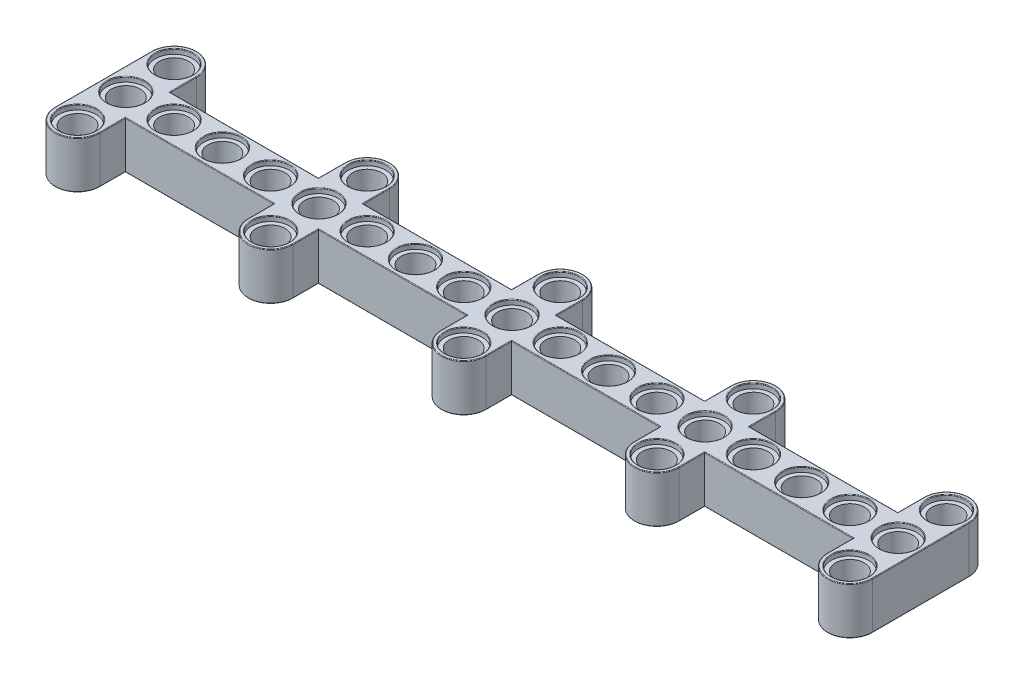
from build123d import *

# Parameters (mm, degrees)
IZIM1_W                     = 7.4
IZIM1_H                     = 7.8
Y_KSEKLIK_EKSTR_ZYON1_DEPTH = 23.4
IZIM2_R                     = 2.4
KES_EKSTR_ZYON1_DEPTH       = 7.8
RADYUS1_RADIUS              = 3.7
RADYUS1_LENGTH              = 7.8
RADYUS2_RADIUS              = 3.7
RADYUS2_LENGTH              = 7.8
IZIM3_R                     = 3.1
KES_EKSTR_ZYON2_DEPTH       = 0.8
KES_EKSTR_ZYON3_START       = -0.8
IZIM4_R                     = 3.1
KES_EKSTR_ZYON3_DEPTH       = 0.8
IZIM5_W                     = 7.4
IZIM5_H                     = 7.8
Y_KSEKLIK_EKSTR_ZYON2_DEPTH = 128
IZIM6_R                     = 2.4
KES_EKSTR_ZYON4_DEPTH       = 7.8
IZIM7_R                     = 3.1
KES_EKSTR_ZYON5_DEPTH       = 0.8
IZIM8_W                     = 7.4
IZIM8_H                     = 23.4
Y_KSEKLIK_EKSTR_ZYON3_DEPTH = 7.8
IZIM11_W                    = 7.4
IZIM11_H                    = 23.4
Y_KSEKLIK_EKSTR_ZYON5_DEPTH = 7.8
IZIM12_R                    = 2.4
KES_EKSTR_ZYON6_DEPTH       = 7.8
IZIM13_R                    = 3.1
KES_EKSTR_ZYON7_DEPTH       = 0.8
RADYUS3_RADIUS              = 3.7
RADYUS3_LENGTH              = 7.8
RADYUS4_RADIUS              = 3.7
RADYUS4_LENGTH              = 7.8
RADYUS5_RADIUS              = 3.7
RADYUS5_LENGTH              = 7.8
RADYUS6_RADIUS              = 3.7
RADYUS6_LENGTH              = 7.8
RADYUS7_RADIUS              = 3.7
RADYUS7_LENGTH              = 7.8
RADYUS8_RADIUS              = 3.7
RADYUS8_LENGTH              = 7.8
RADYUS9_RADIUS              = 3.7
RADYUS9_LENGTH              = 7.8
RADYUS10_RADIUS             = 3.7
RADYUS10_LENGTH             = 7.8
IZIM15_R                    = 2.4
KES_EKSTR_ZYON8_DEPTH       = 7.8
IZIM16_R                    = 3.1
KES_EKSTR_ZYON9_DEPTH       = 0.8
RADYUS11_R                  = 0.1
RADYUS12_R                  = 0.1


with BuildPart() as part:
    # Çizim1 → Yükseklik-Ekstrüzyon1 (new body)
    with BuildSketch(Plane.XY):
        Rectangle(IZIM1_W, IZIM1_H)
    extrude(amount=Y_KSEKLIK_EKSTR_ZYON1_DEPTH)

    # Çizim2 → Kes-Ekstrüzyon1 (cut)
    with BuildSketch(Plane(origin=(0, 3.9, 0), x_dir=(1, 0, 0), z_dir=(0, 1, 0))):
        with Locations(Location((0, -11.7, 0), (0, 0, 270))):
            Circle(IZIM2_R)
        with Locations(Location((0, -3.7, 0), (0, 0, 270))):
            Circle(IZIM2_R)
        with Locations(Location((0, -19.7, 0), (0, 0, 270))):
            Circle(IZIM2_R)
    extrude(amount=-KES_EKSTR_ZYON1_DEPTH, mode=Mode.SUBTRACT)

    # Radyus1: full round fillet: the end face becomes a half cylinder, R = half its width
    radyus1_face = Plane((0, 0, 23.4), x_dir=(0, -1, 0), z_dir=(0, 0, 1))  # on the end face: x along it, z out of the body
    radyus1_slab = radyus1_face.offset(-RADYUS1_RADIUS / 2) * Box(RADYUS1_LENGTH, 2 * RADYUS1_RADIUS, RADYUS1_RADIUS, mode=Mode.PRIVATE)  # the body's end, R deep
    radyus1_round = Plane((0, 0, 19.7), x_dir=(0, 0, 1), z_dir=(0, -1, 0)) * Cylinder(RADYUS1_RADIUS, RADYUS1_LENGTH, mode=Mode.PRIVATE)  # its axis R under the face
    add(radyus1_slab - radyus1_round, mode=Mode.SUBTRACT)

    # Radyus2: full round fillet: the end face becomes a half cylinder, R = half its width
    radyus2_face = Plane((0, 0, 0), x_dir=(0, 1, 0), z_dir=(0, 0, -1))  # on the end face: x along it, z out of the body
    radyus2_slab = radyus2_face.offset(-RADYUS2_RADIUS / 2) * Box(RADYUS2_LENGTH, 2 * RADYUS2_RADIUS, RADYUS2_RADIUS, mode=Mode.PRIVATE)  # the body's end, R deep
    radyus2_round = Plane((0, 0, 3.7), x_dir=(0, 0, -1), z_dir=(0, 1, 0)) * Cylinder(RADYUS2_RADIUS, RADYUS2_LENGTH, mode=Mode.PRIVATE)  # its axis R under the face
    add(radyus2_slab - radyus2_round, mode=Mode.SUBTRACT)

    # Çizim3 → Kes-Ekstrüzyon2 (cut)
    with BuildSketch(Plane(origin=(0, 3.9, 0), x_dir=(1, 0, 0), z_dir=(0, 1, 0))):
        with Locations(Location((0, -3.7, 0), (0, 0, 270))):
            Circle(IZIM3_R)
        with Locations(Location((0, -11.7, 0), (0, 0, 270))):
            Circle(IZIM3_R)
        with Locations(Location((0, -19.7, 0), (0, 0, 270))):
            Circle(IZIM3_R)
    extrude(amount=-KES_EKSTR_ZYON2_DEPTH, mode=Mode.SUBTRACT)

    # Çizim4 → Kes-Ekstrüzyon3 (cut)
    with BuildSketch(Plane(origin=(0, -3.9, 0), x_dir=(-1, 0, 0), z_dir=(0, -1, 0)).offset(KES_EKSTR_ZYON3_START)):
        with Locations(Location((0, -3.7, 0), (0, 0, 270))):
            Circle(IZIM4_R)
        with Locations(Location((0, -11.7, 0), (0, 0, 270))):
            Circle(IZIM4_R)
        with Locations(Location((0, -19.7, 0), (0, 0, 270))):
            Circle(IZIM4_R)
    extrude(amount=KES_EKSTR_ZYON3_DEPTH, mode=Mode.SUBTRACT)

    # Çizim5 → Yükseklik-Ekstrüzyon2 (add)
    with BuildSketch(Plane(origin=(3.7, 0, 0), x_dir=(0, 0, -1), z_dir=(1, 0, 0))):
        with Locations((-11.769993107, 0)):
            Rectangle(IZIM5_W, IZIM5_H)
    extrude(amount=Y_KSEKLIK_EKSTR_ZYON2_DEPTH)

    # Çizim6 → Kes-Ekstrüzyon4 (cut)
    with BuildSketch(Plane(origin=(0, 3.9, 0), x_dir=(1, 0, 0), z_dir=(0, 1, 0))):
        with Locations(Location((8, -11.7, 0), (0, 0, 270))):
            Circle(IZIM6_R)
        with Locations(Location((16, -11.7, 0), (0, 0, 270))):
            Circle(IZIM6_R)
        with Locations(Location((24, -11.7, 0), (0, 0, 270))):
            Circle(IZIM6_R)
        with Locations(Location((32, -11.7, 0), (0, 0, 270))):
            Circle(IZIM6_R)
        with Locations(Location((40, -11.7, 0), (0, 0, 270))):
            Circle(IZIM6_R)
        with Locations(Location((48, -11.7, 0), (0, 0, 270))):
            Circle(IZIM6_R)
        with Locations(Location((56, -11.7, 0), (0, 0, 270))):
            Circle(IZIM6_R)
        with Locations(Location((64, -11.7, 0), (0, 0, 270))):
            Circle(IZIM6_R)
        with Locations(Location((72, -11.7, 0), (0, 0, 270))):
            Circle(IZIM6_R)
        with Locations(Location((80, -11.7, 0), (0, 0, 270))):
            Circle(IZIM6_R)
        with Locations(Location((88, -11.7, 0), (0, 0, 270))):
            Circle(IZIM6_R)
        with Locations(Location((96, -11.7, 0), (0, 0, 270))):
            Circle(IZIM6_R)
        with Locations(Location((104, -11.7, 0), (0, 0, 270))):
            Circle(IZIM6_R)
        with Locations(Location((112, -11.7, 0), (0, 0, 270))):
            Circle(IZIM6_R)
    extrude(amount=-KES_EKSTR_ZYON4_DEPTH, mode=Mode.SUBTRACT)

    # Çizim7 → Kes-Ekstrüzyon5 (cut)
    with BuildSketch(Plane(origin=(0, 3.9, 0), x_dir=(1, 0, 0), z_dir=(0, 1, 0))):
        with Locations(Location((8, -11.7, 0), (0, 0, 270))):
            Circle(IZIM7_R)
        with Locations(Location((16, -11.7, 0), (0, 0, 270))):
            Circle(IZIM7_R)
        with Locations(Location((24, -11.7, 0), (0, 0, 270))):
            Circle(IZIM7_R)
        with Locations(Location((32, -11.7, 0), (0, 0, 270))):
            Circle(IZIM7_R)
        with Locations(Location((40, -11.7, 0), (0, 0, 270))):
            Circle(IZIM7_R)
        with Locations(Location((48, -11.7, 0), (0, 0, 270))):
            Circle(IZIM7_R)
        with Locations(Location((56, -11.7, 0), (0, 0, 270))):
            Circle(IZIM7_R)
        with Locations(Location((64, -11.7, 0), (0, 0, 270))):
            Circle(IZIM7_R)
        with Locations(Location((72, -11.7, 0), (0, 0, 270))):
            Circle(IZIM7_R)
        with Locations(Location((80, -11.7, 0), (0, 0, 270))):
            Circle(IZIM7_R)
        with Locations(Location((88, -11.7, 0), (0, 0, 270))):
            Circle(IZIM7_R)
        with Locations(Location((96, -11.7, 0), (0, 0, 270))):
            Circle(IZIM7_R)
        with Locations(Location((104, -11.7, 0), (0, 0, 270))):
            Circle(IZIM7_R)
        with Locations(Location((112, -11.7, 0), (0, 0, 270))):
            Circle(IZIM7_R)
    kes_ekstr_zyon5 = extrude(amount=-KES_EKSTR_ZYON5_DEPTH, mode=Mode.SUBTRACT)

    # Aynalama1: Kes-Ekstrüzyon5 across plane
    add(kes_ekstr_zyon5.mirror(Plane.ZX), mode=Mode.SUBTRACT)

    # Çizim8 → Yükseklik-Ekstrüzyon3 (add)
    with BuildSketch(Plane.XZ.offset(3.9)):
        with Locations((32, 11.7)):
            Rectangle(IZIM8_W, IZIM8_H)
    extrude(amount=-Y_KSEKLIK_EKSTR_ZYON3_DEPTH)

    # Çizim11 → Yükseklik-Ekstrüzyon5 (add)
    with BuildSketch(Plane.XZ.offset(3.9)):
        with Locations((64, 11.7)):
            Rectangle(IZIM11_W, IZIM11_H)
        with Locations((32, 11.7)):
            Rectangle(IZIM11_W, IZIM11_H)
        with Locations((96, 11.7)):
            Rectangle(IZIM11_W, IZIM11_H)
        with Locations((128, 11.7)):
            Rectangle(IZIM11_W, IZIM11_H)
    extrude(amount=-Y_KSEKLIK_EKSTR_ZYON5_DEPTH)

    # Çizim12 → Kes-Ekstrüzyon6 (cut)
    with BuildSketch(Plane(origin=(0, 3.9, 0), x_dir=(1, 0, 0), z_dir=(0, 1, 0))):
        with Locations(Location((32, -3.7, 0), (0, 0, 270))):
            Circle(IZIM12_R)
        with Locations(Location((32, -19.7, 0), (0, 0, 270))):
            Circle(IZIM12_R)
        with Locations(Location((64, -19.7, 0), (0, 0, 270))):
            Circle(IZIM12_R)
        with Locations(Location((32, -11.7, 0), (0, 0, 270))):
            Circle(IZIM12_R)
        with Locations(Location((64, -3.7, 0), (0, 0, 270))):
            Circle(IZIM12_R)
        with Locations(Location((96, -19.7, 0), (0, 0, 270))):
            Circle(IZIM12_R)
        with Locations(Location((64, -11.7, 0), (0, 0, 270))):
            Circle(IZIM12_R)
        with Locations(Location((96, -3.7, 0), (0, 0, 270))):
            Circle(IZIM12_R)
        with Locations(Location((128, -19.7, 0), (0, 0, 270))):
            Circle(IZIM12_R)
        with Locations(Location((96, -11.7, 0), (0, 0, 270))):
            Circle(IZIM12_R)
        with Locations(Location((128, -3.7, 0), (0, 0, 270))):
            Circle(IZIM12_R)
        with Locations(Location((128, -11.7, 0), (0, 0, 270))):
            Circle(IZIM12_R)
    extrude(amount=-KES_EKSTR_ZYON6_DEPTH, mode=Mode.SUBTRACT)

    # Çizim13 → Kes-Ekstrüzyon7 (cut)
    with BuildSketch(Plane(origin=(0, 3.9, 0), x_dir=(1, 0, 0), z_dir=(0, 1, 0))):
        with Locations(Location((32, -3.7, 0), (0, 0, 270))):
            Circle(IZIM13_R)
        with Locations(Location((32, -11.7, 0), (0, 0, 270))):
            Circle(IZIM13_R)
        with Locations(Location((32, -19.7, 0), (0, 0, 270))):
            Circle(IZIM13_R)
        with Locations(Location((64, -11.7, 0), (0, 0, 270))):
            Circle(IZIM13_R)
        with Locations(Location((64, -19.7, 0), (0, 0, 270))):
            Circle(IZIM13_R)
        with Locations(Location((64, -3.7, 0), (0, 0, 270))):
            Circle(IZIM13_R)
        with Locations(Location((96, -11.7, 0), (0, 0, 270))):
            Circle(IZIM13_R)
        with Locations(Location((96, -19.7, 0), (0, 0, 270))):
            Circle(IZIM13_R)
        with Locations(Location((96, -3.7, 0), (0, 0, 270))):
            Circle(IZIM13_R)
        with Locations(Location((128, -11.7, 0), (0, 0, 270))):
            Circle(IZIM13_R)
        with Locations(Location((128, -19.7, 0), (0, 0, 270))):
            Circle(IZIM13_R)
        with Locations(Location((128, -3.7, 0), (0, 0, 270))):
            Circle(IZIM13_R)
    kes_ekstr_zyon7 = extrude(amount=-KES_EKSTR_ZYON7_DEPTH, mode=Mode.SUBTRACT)

    # Aynalama2: Kes-Ekstrüzyon7 across plane
    add(kes_ekstr_zyon7.mirror(Plane.ZX), mode=Mode.SUBTRACT)

    # Radyus3: full round fillet: the end face becomes a half cylinder, R = half its width
    radyus3_face = Plane((32, 0, 0), x_dir=(0, 1, 0), z_dir=(0, 0, -1))  # on the end face: x along it, z out of the body
    radyus3_slab = radyus3_face.offset(-RADYUS3_RADIUS / 2) * Box(RADYUS3_LENGTH, 2 * RADYUS3_RADIUS, RADYUS3_RADIUS, mode=Mode.PRIVATE)  # the body's end, R deep
    radyus3_round = Plane((32, 0, 3.7), x_dir=(0, 0, -1), z_dir=(0, 1, 0)) * Cylinder(RADYUS3_RADIUS, RADYUS3_LENGTH, mode=Mode.PRIVATE)  # its axis R under the face
    add(radyus3_slab - radyus3_round, mode=Mode.SUBTRACT)

    # Radyus4: full round fillet: the end face becomes a half cylinder, R = half its width
    radyus4_face = Plane((32, 0, 23.4), x_dir=(0, 1, 0), z_dir=(0, 0, 1))  # on the end face: x along it, z out of the body
    radyus4_slab = radyus4_face.offset(-RADYUS4_RADIUS / 2) * Box(RADYUS4_LENGTH, 2 * RADYUS4_RADIUS, RADYUS4_RADIUS, mode=Mode.PRIVATE)  # the body's end, R deep
    radyus4_round = Plane((32, 0, 19.7), x_dir=(0, 0, 1), z_dir=(0, 1, 0)) * Cylinder(RADYUS4_RADIUS, RADYUS4_LENGTH, mode=Mode.PRIVATE)  # its axis R under the face
    add(radyus4_slab - radyus4_round, mode=Mode.SUBTRACT)

    # Radyus5: full round fillet: the end face becomes a half cylinder, R = half its width
    radyus5_face = Plane((64, 0, 0), x_dir=(0, 1, 0), z_dir=(0, 0, -1))  # on the end face: x along it, z out of the body
    radyus5_slab = radyus5_face.offset(-RADYUS5_RADIUS / 2) * Box(RADYUS5_LENGTH, 2 * RADYUS5_RADIUS, RADYUS5_RADIUS, mode=Mode.PRIVATE)  # the body's end, R deep
    radyus5_round = Plane((64, 0, 3.7), x_dir=(0, 0, -1), z_dir=(0, 1, 0)) * Cylinder(RADYUS5_RADIUS, RADYUS5_LENGTH, mode=Mode.PRIVATE)  # its axis R under the face
    add(radyus5_slab - radyus5_round, mode=Mode.SUBTRACT)

    # Radyus6: full round fillet: the end face becomes a half cylinder, R = half its width
    radyus6_face = Plane((64, 0, 23.4), x_dir=(0, 1, 0), z_dir=(0, 0, 1))  # on the end face: x along it, z out of the body
    radyus6_slab = radyus6_face.offset(-RADYUS6_RADIUS / 2) * Box(RADYUS6_LENGTH, 2 * RADYUS6_RADIUS, RADYUS6_RADIUS, mode=Mode.PRIVATE)  # the body's end, R deep
    radyus6_round = Plane((64, 0, 19.7), x_dir=(0, 0, 1), z_dir=(0, 1, 0)) * Cylinder(RADYUS6_RADIUS, RADYUS6_LENGTH, mode=Mode.PRIVATE)  # its axis R under the face
    add(radyus6_slab - radyus6_round, mode=Mode.SUBTRACT)

    # Radyus7: full round fillet: the end face becomes a half cylinder, R = half its width
    radyus7_face = Plane((96, 0, 23.4), x_dir=(0, 1, 0), z_dir=(0, 0, 1))  # on the end face: x along it, z out of the body
    radyus7_slab = radyus7_face.offset(-RADYUS7_RADIUS / 2) * Box(RADYUS7_LENGTH, 2 * RADYUS7_RADIUS, RADYUS7_RADIUS, mode=Mode.PRIVATE)  # the body's end, R deep
    radyus7_round = Plane((96, 0, 19.7), x_dir=(0, 0, 1), z_dir=(0, 1, 0)) * Cylinder(RADYUS7_RADIUS, RADYUS7_LENGTH, mode=Mode.PRIVATE)  # its axis R under the face
    add(radyus7_slab - radyus7_round, mode=Mode.SUBTRACT)

    # Radyus8: full round fillet: the end face becomes a half cylinder, R = half its width
    radyus8_face = Plane((96, 0, 0), x_dir=(0, 1, 0), z_dir=(0, 0, -1))  # on the end face: x along it, z out of the body
    radyus8_slab = radyus8_face.offset(-RADYUS8_RADIUS / 2) * Box(RADYUS8_LENGTH, 2 * RADYUS8_RADIUS, RADYUS8_RADIUS, mode=Mode.PRIVATE)  # the body's end, R deep
    radyus8_round = Plane((96, 0, 3.7), x_dir=(0, 0, -1), z_dir=(0, 1, 0)) * Cylinder(RADYUS8_RADIUS, RADYUS8_LENGTH, mode=Mode.PRIVATE)  # its axis R under the face
    add(radyus8_slab - radyus8_round, mode=Mode.SUBTRACT)

    # Radyus9: full round fillet: the end face becomes a half cylinder, R = half its width
    radyus9_face = Plane((128, 0, 23.4), x_dir=(0, 1, 0), z_dir=(0, 0, 1))  # on the end face: x along it, z out of the body
    radyus9_slab = radyus9_face.offset(-RADYUS9_RADIUS / 2) * Box(RADYUS9_LENGTH, 2 * RADYUS9_RADIUS, RADYUS9_RADIUS, mode=Mode.PRIVATE)  # the body's end, R deep
    radyus9_round = Plane((128, 0, 19.7), x_dir=(0, 0, 1), z_dir=(0, 1, 0)) * Cylinder(RADYUS9_RADIUS, RADYUS9_LENGTH, mode=Mode.PRIVATE)  # its axis R under the face
    add(radyus9_slab - radyus9_round, mode=Mode.SUBTRACT)

    # Radyus10: full round fillet: the end face becomes a half cylinder, R = half its width
    radyus10_face = Plane((128, 0, 0), x_dir=(0, 1, 0), z_dir=(0, 0, -1))  # on the end face: x along it, z out of the body
    radyus10_slab = radyus10_face.offset(-RADYUS10_RADIUS / 2) * Box(RADYUS10_LENGTH, 2 * RADYUS10_RADIUS, RADYUS10_RADIUS, mode=Mode.PRIVATE)  # the body's end, R deep
    radyus10_round = Plane((128, 0, 3.7), x_dir=(0, 0, -1), z_dir=(0, 1, 0)) * Cylinder(RADYUS10_RADIUS, RADYUS10_LENGTH, mode=Mode.PRIVATE)  # its axis R under the face
    add(radyus10_slab - radyus10_round, mode=Mode.SUBTRACT)

    # Çizim15 → Kes-Ekstrüzyon8 (cut)
    with BuildSketch(Plane(origin=(0, 3.9, 0), x_dir=(1, 0, 0), z_dir=(0, 1, 0))):
        with Locations(Location((120, -11.7, 0), (0, 0, 270))):
            Circle(IZIM15_R)
    extrude(amount=-KES_EKSTR_ZYON8_DEPTH, mode=Mode.SUBTRACT)

    # Çizim16 → Kes-Ekstrüzyon9 (cut)
    with BuildSketch(Plane(origin=(0, 3.9, 0), x_dir=(1, 0, 0), z_dir=(0, 1, 0))):
        with Locations(Location((120, -11.7, 0), (0, 0, 270))):
            Circle(IZIM16_R)
    kes_ekstr_zyon9 = extrude(amount=-KES_EKSTR_ZYON9_DEPTH, mode=Mode.SUBTRACT)

    # Aynalama3: Kes-Ekstrüzyon9 across plane
    add(kes_ekstr_zyon9.mirror(Plane.ZX), mode=Mode.SUBTRACT)

    # Radyus11
    radyus11_edges = [part.edges().sort_by_distance(p)[0] for p in [
        (8, -3.9, 8.6),
        (16, -3.9, 8.6),
        (24, -3.9, 8.6),
        (40, -3.9, 8.6),
        (3.7, -3.9, 17.584996553),
        (48, -3.9, 8.6),
        (56, -3.9, 8.6),
        (-3.7, -3.9, 11.7),
        (72, -3.9, 8.6),
        (80, -3.9, 8.6),
        (88, -3.9, 8.6),
        (104, -3.9, 8.6),
        (112, -3.9, 8.6),
        (0, -3.9, 23.4),
        (16, -3.9, 15.469993107),
        (16, -3.9, 8.069993107),
        (28.3, -3.9, 5.884996553),
        (35.7, -3.9, 17.584996553),
        (48, -3.9, 15.469993107),
        (0, -3.9, 0),
        (48, -3.9, 8.069993107),
        (60.3, -3.9, 5.884996553),
        (67.7, -3.9, 17.584996553),
        (80, -3.9, 8.069993107),
        (80, -3.9, 15.469993107),
        (92.3, -3.9, 5.884996553),
        (99.7, -3.9, 17.584996553),
        (112, -3.9, 8.069993107),
        (112, -3.9, 15.469993107),
        (124.3, -3.9, 5.884996553),
        (128, -3.9, 16.6),
        (128, -3.9, 8.6),
        (128, -3.9, 0.6),
        (32, -3.9, 8.6),
        (32, -3.9, 16.6),
        (64, -3.9, 0.6),
        (0, -3.9, 0.6),
        (64, -3.9, 8.6),
        (96, -3.9, 16.6),
        (96, -3.9, 8.6),
        (96, -3.9, 0.6),
        (64, -3.9, 16.6),
        (32, -3.9, 0.6),
        (0, -3.9, 8.6),
        (35.7, -3.9, 5.884996553),
        (32, -3.9, 0),
        (28.3, -3.9, 17.584996553),
        (32, -3.9, 23.4),
        (0, -3.9, 16.6),
        (67.7, -3.9, 5.884996553),
        (64, -3.9, 0),
        (60.3, -3.9, 17.584996553),
        (64, -3.9, 23.4),
        (92.3, -3.9, 17.584996553),
        (96, -3.9, 23.4),
        (99.7, -3.9, 5.884996553),
        (96, -3.9, 0),
        (124.3, -3.9, 17.584996553),
        (131.7, -3.9, 11.7),
        (128, -3.9, 23.4),
        (128, -3.9, 0),
        (120, -3.9, 8.6),
        (3.7, -3.9, 5.884996553),
    ]]
    fillet(radyus11_edges, radius=RADYUS11_R)

    # Radyus12
    radyus12_edges = [part.edges().sort_by_distance(p)[0] for p in [
        (8, 3.9, 8.6),
        (16, 3.9, 8.6),
        (24, 3.9, 8.6),
        (40, 3.9, 8.6),
        (48, 3.9, 8.6),
        (56, 3.9, 8.6),
        (72, 3.9, 8.6),
        (80, 3.9, 8.6),
        (88, 3.9, 8.6),
        (104, 3.9, 8.6),
        (112, 3.9, 8.6),
        (3.7, 3.9, 17.584996553),
        (-3.7, 3.9, 11.7),
        (0, 3.9, 23.4),
        (16, 3.9, 15.469993107),
        (16, 3.9, 8.069993107),
        (35.7, 3.9, 5.884996553),
        (28.3, 3.9, 17.584996553),
        (0, 3.9, 0),
        (48, 3.9, 15.469993107),
        (48, 3.9, 8.069993107),
        (67.7, 3.9, 5.884996553),
        (60.3, 3.9, 17.584996553),
        (80, 3.9, 15.469993107),
        (80, 3.9, 8.069993107),
        (99.7, 3.9, 5.884996553),
        (92.3, 3.9, 17.584996553),
        (112, 3.9, 15.469993107),
        (112, 3.9, 8.069993107),
        (124.3, 3.9, 17.584996553),
        (0, 3.9, 0.6),
        (0, 3.9, 8.6),
        (0, 3.9, 16.6),
        (128, 3.9, 16.6),
        (128, 3.9, 8.6),
        (128, 3.9, 0.6),
        (32, 3.9, 8.6),
        (32, 3.9, 16.6),
        (64, 3.9, 0.6),
        (64, 3.9, 8.6),
        (96, 3.9, 16.6),
        (96, 3.9, 8.6),
        (96, 3.9, 0.6),
        (64, 3.9, 16.6),
        (32, 3.9, 0.6),
        (28.3, 3.9, 5.884996553),
        (32, 3.9, 0),
        (35.7, 3.9, 17.584996553),
        (32, 3.9, 23.4),
        (60.3, 3.9, 5.884996553),
        (64, 3.9, 0),
        (67.7, 3.9, 17.584996553),
        (64, 3.9, 23.4),
        (99.7, 3.9, 17.584996553),
        (96, 3.9, 23.4),
        (92.3, 3.9, 5.884996553),
        (96, 3.9, 0),
        (128, 3.9, 23.4),
        (124.3, 3.9, 5.884996553),
        (131.7, 3.9, 11.7),
        (128, 3.9, 0),
        (120, 3.9, 8.6),
        (3.7, 3.9, 5.884996553),
    ]]
    fillet(radyus12_edges, radius=RADYUS12_R)


solid = part.part
